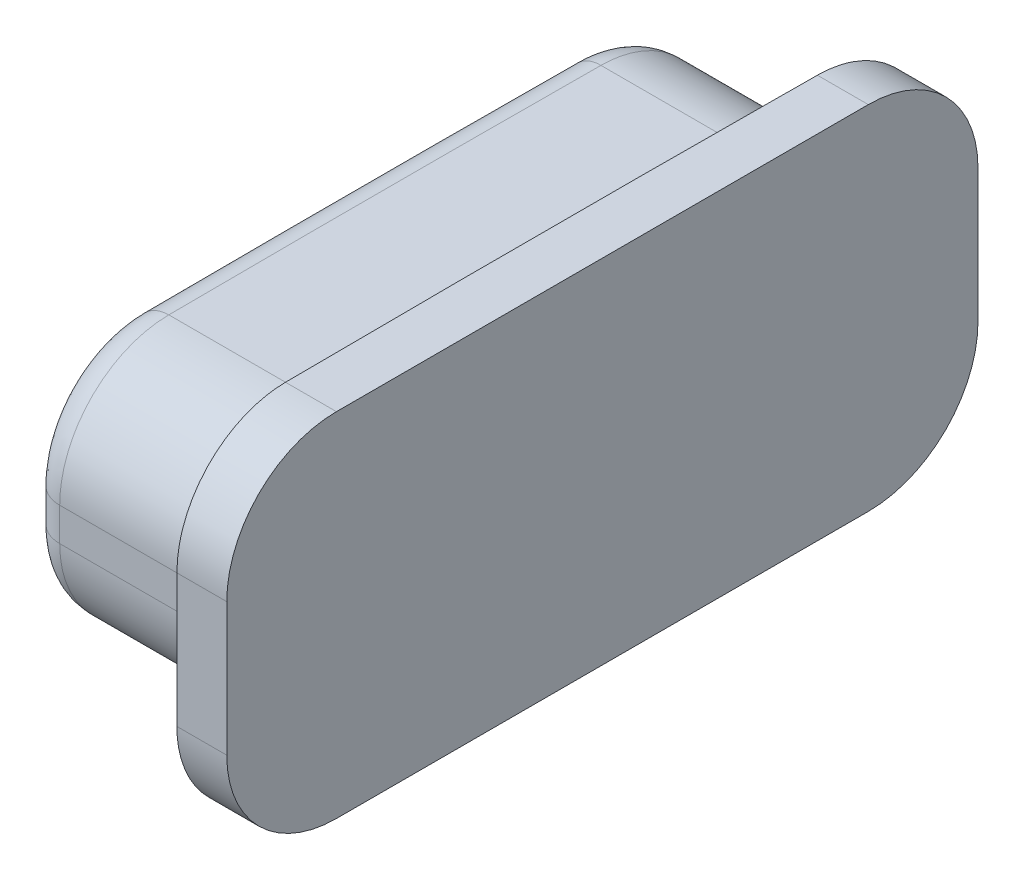
from build123d import *

# Parameters (mm, degrees)
BOSS_EXTRUDE1_DEPTH = 2.65
CUT_EXTRUDE2_DEPTH  = 0.75
FILLET3_R           = 1.65
FILLET4_R           = 0.5


with BuildPart() as part:
    # Sketch1 → Boss-Extrude1 (new, symmetric)
    with BuildSketch(Plane(origin=(0, 0, 0), x_dir=(1, 0, 0), z_dir=(0, 1, 0))):
        with BuildLine():
            Line((-20.776037351, 4.9), (-17.775892991, 4.9))
            ThreePointArc((-17.775892991, 4.9), (-17.772061826, 5.275001496), (-17.767948266, 5.65))
            Line((-17.767948266, 5.65), (-17.017899919, 5.65))
            Line((-17.017899919, 5.65), (-17.017899919, -5.65))
            Line((-17.017899919, -5.65), (-17.767948266, -5.65))
            ThreePointArc((-17.767948266, -5.65), (-17.772061826, -5.275001496), (-17.775892991, -4.9))
            Line((-17.775892991, -4.9), (-20.776037351, -4.9))
            ThreePointArc((-20.776037351, -4.9), (-20.8, 0), (-20.776037351, 4.9))
        make_face()
    extrude(amount=BOSS_EXTRUDE1_DEPTH, both=True)

    # Sketch2 → Cut-Extrude2 (cut)
    with BuildSketch(Plane(origin=(0, 2.65, 0), x_dir=(1, 0, 0), z_dir=(0, 1, 0))):
        with BuildLine():
            Line((-17.775892991, 4.9), (-20.776037348, 4.9))
            ThreePointArc((-20.776037348, 4.9), (-20.799999997, 0), (-20.776037348, -4.9))
            Line((-20.776037348, -4.9), (-17.775892991, -4.9))
            ThreePointArc((-17.775892991, -4.9), (-17.8, 0), (-17.775892991, 4.9))
        make_face()
    cut_extrude2 = extrude(amount=-CUT_EXTRUDE2_DEPTH, mode=Mode.SUBTRACT)

    # Mirror1: Cut-Extrude2 across plane
    add(cut_extrude2.mirror(Plane.ZX), mode=Mode.SUBTRACT)

    # Fillet3
    # the kernel refuses this fillet: 1.65 mm, written as the material it takes off along each edge
    with BuildSketch(Plane(origin=(-17.017899919, 2.65, 5.65), x_dir=(0, 0, -1), z_dir=(-1, 0, 0))) as fillet3_piece_1_section:
        with BuildLine():
            CenterArc((FILLET3_R, FILLET3_R), FILLET3_R, 180, 90)
            Line((0, FILLET3_R), (-FILLET3_R * 0.02, FILLET3_R))
            Line((-FILLET3_R * 0.02, FILLET3_R), (-FILLET3_R * 0.02, -FILLET3_R * 0.02))
            Line((-FILLET3_R * 0.02, -FILLET3_R * 0.02), (FILLET3_R, -FILLET3_R * 0.02))
            Line((FILLET3_R, -FILLET3_R * 0.02), (FILLET3_R, 0))
        make_face()
    fillet3_piece_1 = extrude(amount=4.875048347, mode=Mode.PRIVATE)
    fillet3_piece_1 = fillet3_piece_1 & Plane(origin=(480.200000514, 2.277476363, -5e-09), x_dir=(-0.9999356390878598, 0, 0.011345381525254326), z_dir=(0, 1, 0)) * Cylinder(498.000000514, 17, mode=Mode.PRIVATE)
    add(fillet3_piece_1, mode=Mode.SUBTRACT)
    with BuildSketch(Plane(origin=(-21.892948266, 2.65, -5.65), x_dir=(0, -1, 0), z_dir=(1, 0, 0))) as fillet3_piece_2_section:
        with BuildLine():
            CenterArc((FILLET3_R, -FILLET3_R), FILLET3_R, 90, 90)
            Line((0, -FILLET3_R), (-FILLET3_R * 0.02, -FILLET3_R))
            Line((-FILLET3_R * 0.02, -FILLET3_R), (-FILLET3_R * 0.02, FILLET3_R * 0.02))
            Line((-FILLET3_R * 0.02, FILLET3_R * 0.02), (FILLET3_R, FILLET3_R * 0.02))
            Line((FILLET3_R, FILLET3_R * 0.02), (FILLET3_R, 0))
        make_face()
    fillet3_piece_2 = extrude(amount=4.875048347, mode=Mode.PRIVATE)
    fillet3_piece_2 = fillet3_piece_2 & Plane(origin=(480.200000325, 2.277476179, 3e-09), x_dir=(-0.9999515923510308, 0, -0.009839357430136753), z_dir=(0, 1, 0)) * Cylinder(498.000000325, 17, mode=Mode.PRIVATE)
    add(fillet3_piece_2, mode=Mode.SUBTRACT)
    with BuildSketch(Plane(origin=(-24.901037348, 1.9, 4.9), x_dir=(0, 0, -1), z_dir=(1, 0, 0))) as fillet3_piece_3_section:
        with BuildLine():
            CenterArc((FILLET3_R, -FILLET3_R), FILLET3_R, 90, 90)
            Line((0, -FILLET3_R), (-FILLET3_R * 0.02, -FILLET3_R))
            Line((-FILLET3_R * 0.02, -FILLET3_R), (-FILLET3_R * 0.02, FILLET3_R * 0.02))
            Line((-FILLET3_R * 0.02, FILLET3_R * 0.02), (FILLET3_R, FILLET3_R * 0.02))
            Line((FILLET3_R, FILLET3_R * 0.02), (FILLET3_R, 0))
        make_face()
    fillet3_piece_3 = extrude(amount=11.250144357, mode=Mode.PRIVATE)
    fillet3_piece_3 = fillet3_piece_3 & Plane(origin=(480.2, 1.526447117, 0), x_dir=(-0.9999521703614557, 0, 0.009780439121757674), z_dir=(0, 1, 0)) * Cylinder(501, 30, mode=Mode.PRIVATE)
    fillet3_piece_3 = fillet3_piece_3 - Plane(origin=(480.200000004, 1.526447117, 0), x_dir=(-0.9999515923510358, 0, 0.009839357429633357), z_dir=(0, 1, 0)) * Cylinder(498.000000004, 30, mode=Mode.PRIVATE)
    add(fillet3_piece_3, mode=Mode.SUBTRACT)
    with BuildSketch(Plane(origin=(-13.650892991, 1.9, -4.9), x_dir=(0, -1, 0), z_dir=(-1, 0, 0))) as fillet3_piece_4_section:
        with BuildLine():
            CenterArc((FILLET3_R, FILLET3_R), FILLET3_R, 180, 90)
            Line((0, FILLET3_R), (-FILLET3_R * 0.02, FILLET3_R))
            Line((-FILLET3_R * 0.02, FILLET3_R), (-FILLET3_R * 0.02, -FILLET3_R * 0.02))
            Line((-FILLET3_R * 0.02, -FILLET3_R * 0.02), (FILLET3_R, -FILLET3_R * 0.02))
            Line((FILLET3_R, -FILLET3_R * 0.02), (FILLET3_R, 0))
        make_face()
    fillet3_piece_4 = extrude(amount=11.250144357, mode=Mode.PRIVATE)
    fillet3_piece_4 = fillet3_piece_4 & Plane(origin=(480.2, 1.526445495, 0), x_dir=(-0.9999521703614557, 0, 0.009780439121757674), z_dir=(0, 1, 0)) * Cylinder(501, 30, mode=Mode.PRIVATE)
    fillet3_piece_4 = fillet3_piece_4 - Plane(origin=(480.200000325, 1.526445495, 3e-09), x_dir=(-0.9999515923510308, 0, -0.009839357430136753), z_dir=(0, 1, 0)) * Cylinder(498.000000325, 30, mode=Mode.PRIVATE)
    add(fillet3_piece_4, mode=Mode.SUBTRACT)
    with BuildSketch(Plane(origin=(-13.650892991, -1.9, -4.9), x_dir=(0, 1, 0), z_dir=(-1, 0, 0))) as fillet3_piece_5_section:
        with BuildLine():
            CenterArc((FILLET3_R, -FILLET3_R), FILLET3_R, 90, 90)
            Line((0, -FILLET3_R), (-FILLET3_R * 0.02, -FILLET3_R))
            Line((-FILLET3_R * 0.02, -FILLET3_R), (-FILLET3_R * 0.02, FILLET3_R * 0.02))
            Line((-FILLET3_R * 0.02, FILLET3_R * 0.02), (FILLET3_R, FILLET3_R * 0.02))
            Line((FILLET3_R, FILLET3_R * 0.02), (FILLET3_R, 0))
        make_face()
    fillet3_piece_5 = extrude(amount=11.250144357, mode=Mode.PRIVATE)
    fillet3_piece_5 = fillet3_piece_5 & Plane(origin=(480.2, -1.526445495, 0), x_dir=(-0.9999521703614557, 0, 0.009780439121757674), z_dir=(0, 1, 0)) * Cylinder(501, 30, mode=Mode.PRIVATE)
    fillet3_piece_5 = fillet3_piece_5 - Plane(origin=(480.200000325, -1.526445495, 3e-09), x_dir=(-0.9999515923510308, 0, -0.009839357430136753), z_dir=(0, 1, 0)) * Cylinder(498.000000325, 30, mode=Mode.PRIVATE)
    add(fillet3_piece_5, mode=Mode.SUBTRACT)
    with BuildSketch(Plane(origin=(-24.901037348, -1.9, 4.9), x_dir=(0, 0, -1), z_dir=(1, 0, 0))) as fillet3_piece_6_section:
        with BuildLine():
            CenterArc((FILLET3_R, FILLET3_R), FILLET3_R, 180, 90)
            Line((0, FILLET3_R), (-FILLET3_R * 0.02, FILLET3_R))
            Line((-FILLET3_R * 0.02, FILLET3_R), (-FILLET3_R * 0.02, -FILLET3_R * 0.02))
            Line((-FILLET3_R * 0.02, -FILLET3_R * 0.02), (FILLET3_R, -FILLET3_R * 0.02))
            Line((FILLET3_R, -FILLET3_R * 0.02), (FILLET3_R, 0))
        make_face()
    fillet3_piece_6 = extrude(amount=11.250144357, mode=Mode.PRIVATE)
    fillet3_piece_6 = fillet3_piece_6 & Plane(origin=(480.2, -1.526447117, 0), x_dir=(-0.9999521703614557, 0, 0.009780439121757674), z_dir=(0, 1, 0)) * Cylinder(501, 30, mode=Mode.PRIVATE)
    fillet3_piece_6 = fillet3_piece_6 - Plane(origin=(480.200000004, -1.526447117, 0), x_dir=(-0.9999515923510358, 0, 0.009839357429633357), z_dir=(0, -1, 0)) * Cylinder(498.000000004, 30, mode=Mode.PRIVATE)
    add(fillet3_piece_6, mode=Mode.SUBTRACT)
    with BuildSketch(Plane(origin=(-21.892948266, -2.65, -5.65), x_dir=(0, 0, 1), z_dir=(1, 0, 0))) as fillet3_piece_7_section:
        with BuildLine():
            CenterArc((FILLET3_R, -FILLET3_R), FILLET3_R, 90, 90)
            Line((0, -FILLET3_R), (-FILLET3_R * 0.02, -FILLET3_R))
            Line((-FILLET3_R * 0.02, -FILLET3_R), (-FILLET3_R * 0.02, FILLET3_R * 0.02))
            Line((-FILLET3_R * 0.02, FILLET3_R * 0.02), (FILLET3_R, FILLET3_R * 0.02))
            Line((FILLET3_R, FILLET3_R * 0.02), (FILLET3_R, 0))
        make_face()
    fillet3_piece_7 = extrude(amount=4.875048347, mode=Mode.PRIVATE)
    fillet3_piece_7 = fillet3_piece_7 & Plane(origin=(480.200000325, -2.27747614, 3e-09), x_dir=(-0.9999515923510308, 0, -0.009839357430136753), z_dir=(0, 1, 0)) * Cylinder(498.000000325, 17, mode=Mode.PRIVATE)
    add(fillet3_piece_7, mode=Mode.SUBTRACT)
    with BuildSketch(Plane(origin=(-17.017899919, -2.65, 5.65), x_dir=(0, 0, -1), z_dir=(-1, 0, 0))) as fillet3_piece_8_section:
        with BuildLine():
            CenterArc((FILLET3_R, -FILLET3_R), FILLET3_R, 90, 90)
            Line((0, -FILLET3_R), (-FILLET3_R * 0.02, -FILLET3_R))
            Line((-FILLET3_R * 0.02, -FILLET3_R), (-FILLET3_R * 0.02, FILLET3_R * 0.02))
            Line((-FILLET3_R * 0.02, FILLET3_R * 0.02), (FILLET3_R, FILLET3_R * 0.02))
            Line((FILLET3_R, FILLET3_R * 0.02), (FILLET3_R, 0))
        make_face()
    fillet3_piece_8 = extrude(amount=4.875048347, mode=Mode.PRIVATE)
    fillet3_piece_8 = fillet3_piece_8 & Plane(origin=(480.200000514, -2.277476363, -5e-09), x_dir=(-0.9999356390878598, 0, 0.011345381525254326), z_dir=(0, 1, 0)) * Cylinder(498.000000514, 17, mode=Mode.PRIVATE)
    add(fillet3_piece_8, mode=Mode.SUBTRACT)

    # Fillet4
    fillet4_edges = [part.edges().sort_by_distance(p)[0] for p in [
        (-20.776037351, 0, 4.9),
        (-20.799999997, -1.9, 0),
        (-20.799999997, 1.9, 0),
        (-20.776037351, 0, -4.9),
        (-20.780531146, -1.416733553, -4.416718844),
        (-20.780531153, 1.416733542, -4.416718836),
        (-20.780531153, 1.416733544, 4.416718836),
        (-20.780531146, -1.416733553, 4.416718845),
    ]]
    fillet(fillet4_edges, radius=FILLET4_R)


solid = part.part
